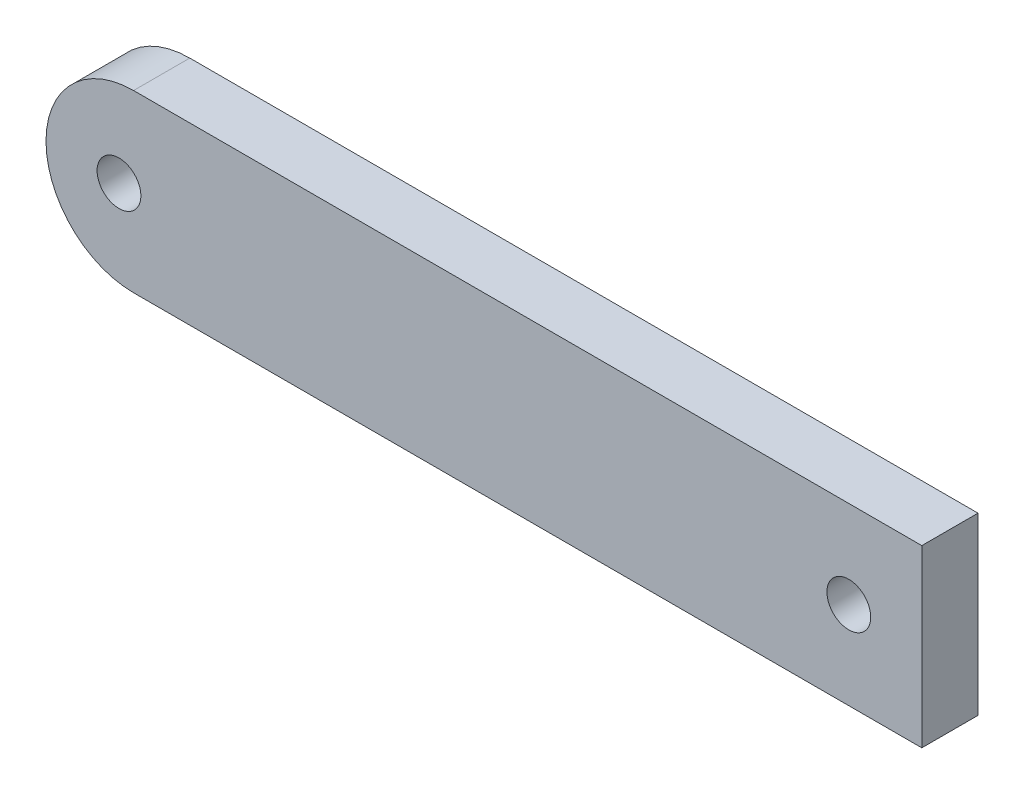
from build123d import *

# Parameters (mm, degrees)
SKETCH_1_W      = 60
SKETCH_1_H      = 12
SKETCH_1_R      = 1.5
EXTRUDE_1_DEPTH = 3.85
FILLET_1_R      = 6


with BuildPart() as part:
    # 草图1 → 凸台-拉伸1 (new body)
    with BuildSketch(Plane.XY):
        with Locations((5, 0)):
            Rectangle(SKETCH_1_W, SKETCH_1_H)
        with Locations(Location((-20, 0, 0), (0, 0, 180))):
            Circle(SKETCH_1_R, mode=Mode.SUBTRACT)
        with Locations(Location((30, 0, 0), (0, 0, 180))):
            Circle(SKETCH_1_R, mode=Mode.SUBTRACT)
    extrude(amount=EXTRUDE_1_DEPTH)

    # 圆角1
    fillet_1_edges = [part.edges().sort_by_distance(p)[0] for p in [
        (-25, -6, 1.925),
        (-25, 6, 1.925),
    ]]
    fillet(fillet_1_edges, radius=FILLET_1_R - 0.0001)  # a hair under: the kernel refuses the full size


solid = part.part
